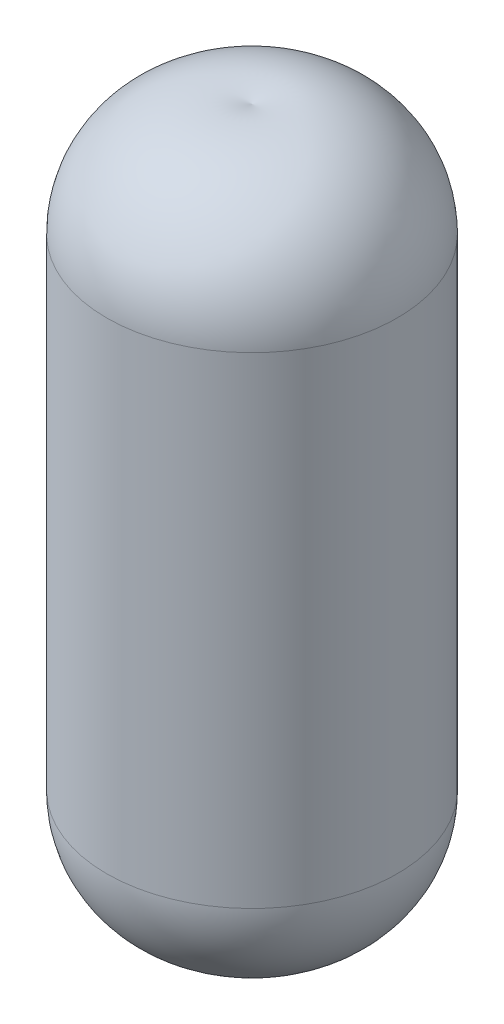
from build123d import *


with BuildPart() as part:
    # Sketch1 → Revolve2 (revolve)
    with BuildSketch(Plane.XY):
        with BuildLine():
            Line((0, 1509.902), (0, -522.098))
            Line((0, -522.098), (0, -979.298))
            ThreePointArc((0, -979.298), (417.972673423, -892.902527187), (605.79, -509.640234118))
            Line((605.79, -509.640234118), (605.79, 1497.444234118))
            ThreePointArc((605.79, 1497.444234118), (417.972673423, 1880.706527187), (0, 1967.102))
            Line((0, 1967.102), (0, 1509.902))
        make_face()
    revolve(axis=Axis((0, 550, 0), (0, -1, 0)))


solid = part.part
